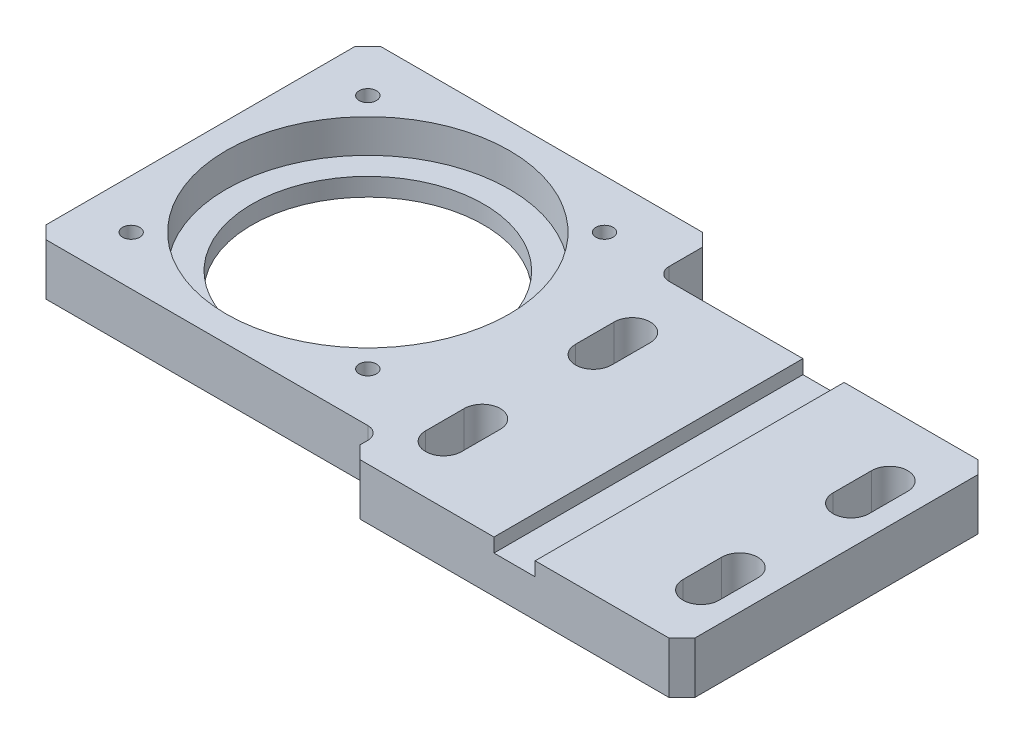
from build123d import *

# Parameters (mm, degrees)
EXTRUDE_1_DEPTH     = 20
SKETCH_3_R          = 45
CUT_EXTRUDE_1_DEPTH = 302.784691461
SKETCH_4_R          = 55
CUT_EXTRUDE_2_DEPTH = 13
SKETCH_5_W          = 16
SKETCH_5_H          = 120
CUT_EXTRUDE_3_DEPTH = 5.4
CUT_EXTRUDE_4_DEPTH = 302.784691461
FILLET_1_R          = 5
CHAMFER_1_SIZE      = 5
SKETCH_7_R          = 3.35
CUT_EXTRUDE_5_DEPTH = 302.784691461


with BuildPart() as part:
    # 草图2 → 凸台-拉伸1 (new body)
    with BuildSketch(Plane(origin=(0, 0, 0), x_dir=(1, 0, 0), z_dir=(0, 1, 0))):
        Polygon((0, 0), (135, 0), (135, -23), (265, -23), (265, -143), (135, -143), (135, -130), (0, -130), align=None)
    extrude(amount=EXTRUDE_1_DEPTH)

    # 草图3 → 切除-拉伸1 (cut, through all)
    with BuildSketch(Plane(origin=(0, 20, 0), x_dir=(1, 0, 0), z_dir=(0, 1, 0))):
        with Locations((65, -65)):
            Circle(SKETCH_3_R)
    extrude(amount=-CUT_EXTRUDE_1_DEPTH, mode=Mode.SUBTRACT)

    # 草图4 → 切除-拉伸2 (cut)
    with BuildSketch(Plane(origin=(0, 20, 0), x_dir=(1, 0, 0), z_dir=(0, 1, 0))):
        with Locations((65, -65)):
            Circle(SKETCH_4_R)
    extrude(amount=-CUT_EXTRUDE_2_DEPTH, mode=Mode.SUBTRACT)

    # 草图5 → 切除-拉伸3 (cut)
    with BuildSketch(Plane(origin=(0, 20, 0), x_dir=(1, 0, 0), z_dir=(0, 1, 0))):
        with Locations((200, -83)):
            Rectangle(SKETCH_5_W, SKETCH_5_H)
    extrude(amount=-CUT_EXTRUDE_3_DEPTH, mode=Mode.SUBTRACT)

    # 草图6 → 切除-拉伸4 (cut, through all)
    with BuildSketch(Plane(origin=(0, 20, 0), x_dir=(1, 0, 0), z_dir=(0, 1, 0))):
        with BuildLine():
            Line((157, -47.312507702), (157, -62.312507702))
            ThreePointArc((157, -62.312507702), (150, -69.312507702), (143, -62.312507702))
            Line((143, -62.312507702), (143, -47.312507702))
            ThreePointArc((143, -47.312507702), (150, -40.312507702), (157, -47.312507702))
        make_face()
        with BuildLine():
            Line((157, -105.55824709), (157, -120.55824709))
            ThreePointArc((157, -120.55824709), (150, -127.55824709), (143, -120.55824709))
            Line((143, -120.55824709), (143, -105.55824709))
            ThreePointArc((143, -105.55824709), (150, -98.55824709), (157, -105.55824709))
        make_face()
        with BuildLine():
            Line((257, -47.312507702), (257, -62.312507702))
            ThreePointArc((257, -62.312507702), (250, -69.312507702), (243, -62.312507702))
            Line((243, -62.312507702), (243, -47.312507702))
            ThreePointArc((243, -47.312507702), (250, -40.312507702), (257, -47.312507702))
        make_face()
        with BuildLine():
            Line((257, -105.55824709), (257, -120.55824709))
            ThreePointArc((257, -120.55824709), (250, -127.55824709), (243, -120.55824709))
            Line((243, -120.55824709), (243, -105.55824709))
            ThreePointArc((243, -105.55824709), (250, -98.55824709), (257, -105.55824709))
        make_face()
    extrude(amount=-CUT_EXTRUDE_4_DEPTH, mode=Mode.SUBTRACT)

    # 圆角1
    fillet_1_edges = [part.edges().sort_by_distance(p)[0] for p in [
        (135, 10, 23),
        (135, 10, 130),
    ]]
    fillet(fillet_1_edges, radius=FILLET_1_R)

    # 倒角1
    chamfer_1_edges = [part.edges().sort_by_distance(p)[0] for p in [
        (265, 10, 23),
        (265, 10, 143),
        (135, 10, 143),
        (135, 10, 0),
        (0, 10, 130),
        (0, 10, 0),
    ]]
    chamfer(chamfer_1_edges, length=CHAMFER_1_SIZE)

    # 草图7 → 切除-拉伸5 (cut, through all)
    with BuildSketch(Plane(origin=(0, 20, 0), x_dir=(1, 0, 0), z_dir=(0, 1, 0))):
        with Locations((110.961940777, -19.038059223)):
            Circle(SKETCH_7_R)
        with Locations((110.961940777, -110.961940777)):
            Circle(SKETCH_7_R)
        with Locations((19.038059223, -110.961940777)):
            Circle(SKETCH_7_R)
        with Locations((19.038059223, -19.038059223)):
            Circle(SKETCH_7_R)
    extrude(amount=-CUT_EXTRUDE_5_DEPTH, mode=Mode.SUBTRACT)


solid = part.part
